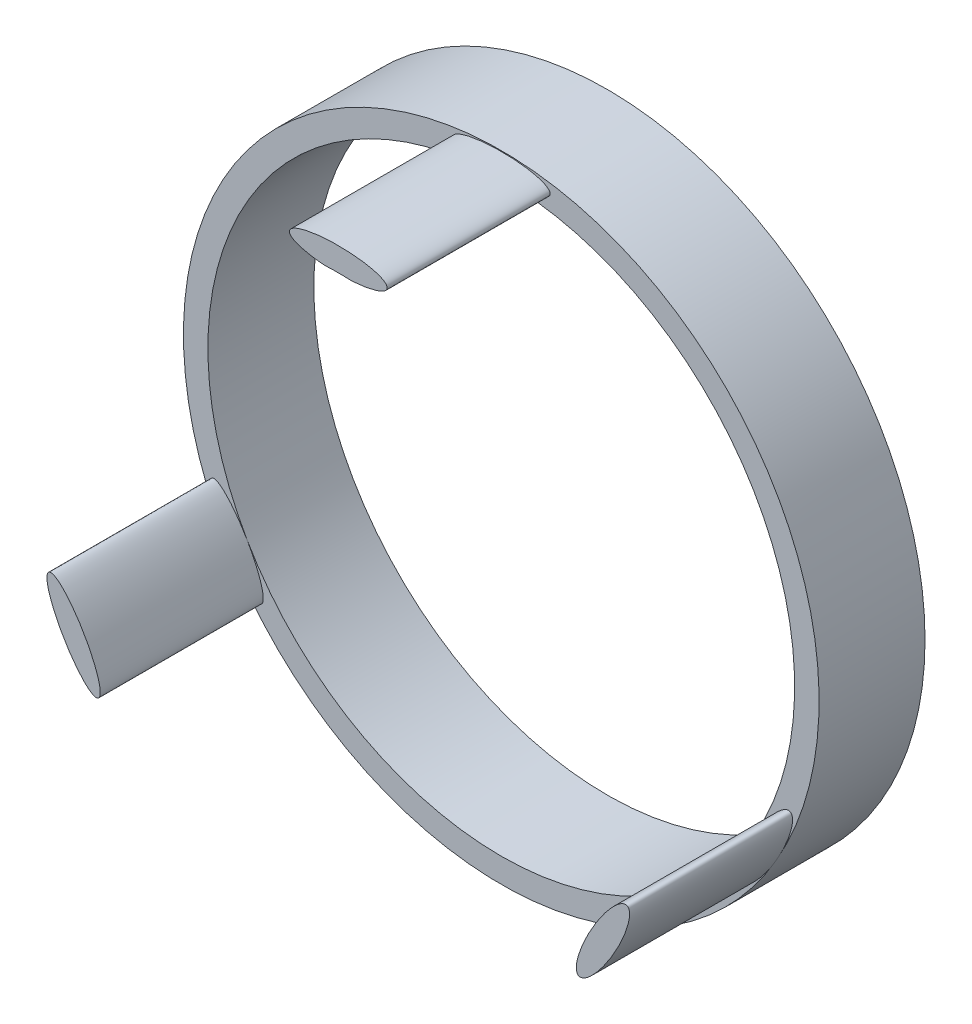
from build123d import *

# Parameters (mm, degrees)
SKETCH1_R           = 19.5
SKETCH1_R_2         = 18
BOSS_EXTRUDE1_DEPTH = 6.5
BOSS_EXTRUDE2_DEPTH = 10


with BuildPart() as part:
    # Sketch1 → Boss-Extrude1 (new body)
    with BuildSketch(Plane.XY):
        Circle(SKETCH1_R)
        Circle(SKETCH1_R_2, mode=Mode.SUBTRACT)
    extrude(amount=BOSS_EXTRUDE1_DEPTH)

    # Sketch2 → Boss-Extrude2 (add)
    with BuildSketch(Plane.XY.offset(6.5)):
        with BuildLine():
            add(Edge.make_bspline(
                [(-17.740345961, -6.772819451), (-18.39089191, -7.14841233), (-16.887494563, -9.749999532)],
                knots=[0, 0, 0, 1.572376088, 1.572376088, 1.572376088], degree=2, weights=[1, 0.706548031, 1]))
            add(Edge.make_bspline(
                [(-16.887494563, -9.749999532), (-15.388839739, -12.343379931), (-14.740345961, -11.968971874), (-14.091852183, -11.594563817), (-15.588458079, -9.000000468)],
                knots=[1.572376088, 1.572376088, 1.572376088, 3.141592654, 3.141592654, 4.71080922, 4.71080922, 4.71080922], degree=2, weights=[1, 0.70766509, 1, 0.70766509, 1]))
            add(Edge.make_bspline(
                [(-15.588458079, -9.000000468), (-17.089800012, -6.397226573), (-17.740345961, -6.772819451)],
                knots=[4.71080922, 4.71080922, 4.71080922, 6.283185307, 6.283185307, 6.283185307], degree=2, weights=[1, 0.706548031, 1]))
        make_face()
        with BuildLine():
            ThreePointArc((-0.852605665, 17.979795983), (0, 18), (0.852605665, 17.979795983))
            add(Edge.make_bspline(
                [(0.852605665, 17.979795983), (3, 18.138931399), (3, 18.698869326)],
                knots=[5.000562868, 5.000562868, 5.000562868, 6.283185307, 6.283185307, 6.283185307], degree=2, weights=[1, 0.801312014, 1]))
            add(Edge.make_bspline(
                [(3, 18.698869326), (3, 19.448869326), (0, 19.448869326)],
                knots=[0, 0, 0, 1.570796327, 1.570796327, 1.570796327], degree=2, weights=[1, 0.707106781, 1]))
            add(Edge.make_bspline(
                [(0, 19.448869326), (-2.596135973, 19.448869326), (-2.968912269, 18.806560998), (-3.341688565, 18.164252669), (-0.852605665, 17.979795983)],
                knots=[1.570796327, 1.570796327, 1.570796327, 2.99750571, 2.99750571, 4.424215093, 4.424215093, 4.424215093], degree=2, weights=[1, 0.756170912, 1, 0.756170912, 1]))
        make_face()
        with BuildLine():
            add(Edge.make_bspline(
                [(16.887495374, -9.75), (18.387495374, -7.151923789), (17.737976321, -6.776923789), (17.088457268, -6.401923789), (15.588457268, -9)],
                knots=[1.570796327, 1.570796327, 1.570796327, 3.141592654, 3.141592654, 4.71238898, 4.71238898, 4.71238898], degree=2, weights=[1, 0.707106781, 1, 0.707106781, 1]))
            add(Edge.make_bspline(
                [(15.588457268, -9), (14.088457268, -11.598076211), (14.737976321, -11.973076211)],
                knots=[4.71238898, 4.71238898, 4.71238898, 6.283185307, 6.283185307, 6.283185307], degree=2, weights=[1, 0.707106781, 1]))
            add(Edge.make_bspline(
                [(14.737976321, -11.973076211), (15.387495374, -12.348076211), (16.887495374, -9.75)],
                knots=[0, 0, 0, 1.570796327, 1.570796327, 1.570796327], degree=2, weights=[1, 0.707106781, 1]))
        make_face()
    extrude(amount=BOSS_EXTRUDE2_DEPTH)


solid = part.part
